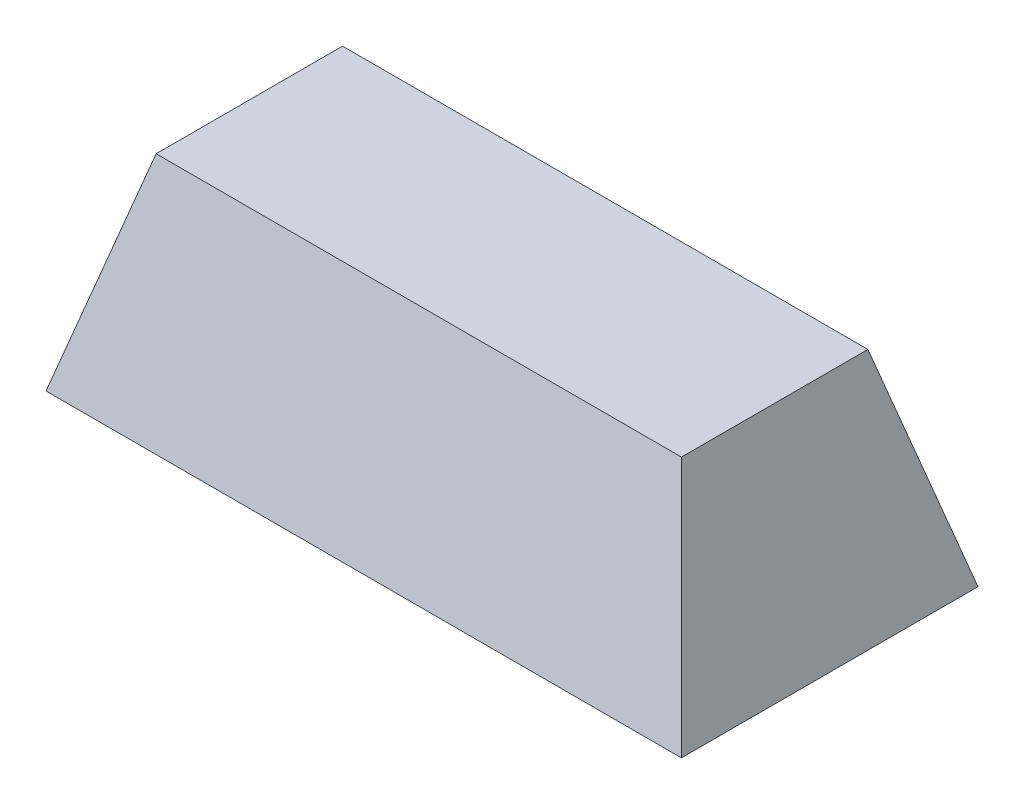
from build123d import *

# Parameters (mm, degrees)
ESQUISSE2_W      = 150
ESQUISSE2_H      = 70
EXTRUSION1_DEPTH = 48.5
EXTRUSION2_REACH = 174.488
CHANFREIN1_SIZE2 = 48.5
CHANFREIN1_SIZE  = 12.995535833
CHANFREIN2_SIZE2 = 48.5
CHANFREIN2_SIZE  = 12.995535833


with BuildPart() as part:
    # Esquisse2 → Extrusion1 (new body)
    with BuildSketch(Plane(origin=(0, 0, 0), x_dir=(1, 0, 0), z_dir=(0, 1, 0))):
        with Locations((75, 35)):
            Rectangle(ESQUISSE2_W, ESQUISSE2_H)
    extrude(amount=EXTRUSION1_DEPTH)

    # Esquisse3 → Extrusion2 (cut, up to next)
    with BuildSketch(Plane.XY, mode=Mode.PRIVATE) as extrusion2_sk1:
        Polygon((0, 0), (0, 48.5), (12.995535833, 48.5), align=None)
    extrusion2_tool1 = extrude(extrusion2_sk1.sketch, amount=-EXTRUSION2_REACH, mode=Mode.PRIVATE) & part.part
    # Esquisse3 → Extrusion2 (cut, up to next)
    with BuildSketch(Plane.XY, mode=Mode.PRIVATE) as extrusion2_sk2:
        Polygon((137.004464167, 48.5), (150, 0), (150, 48.5), align=None)
    extrusion2_tool2 = extrude(extrusion2_sk2.sketch, amount=-EXTRUSION2_REACH, mode=Mode.PRIVATE) & part.part
    add(extrusion2_tool1.solids().sort_by_distance((4.331845, 32.333333, 0))[0], mode=Mode.SUBTRACT)
    add(extrusion2_tool2.solids().sort_by_distance((145.668155, 32.333333, 0))[0], mode=Mode.SUBTRACT)

    # Chanfrein1
    chanfrein1_edges = [part.edges().sort_by_distance(p)[0] for p in [
        (75, 48.5, -70),
    ]]
    chanfrein1_side = [part.faces().sort_by_distance(p)[0] for p in [
        (75, 48.5, -69.740089283),
    ]]
    chamfer(chanfrein1_edges, length=CHANFREIN1_SIZE - 0.0001, length2=CHANFREIN1_SIZE2 - 0.0001, reference=chanfrein1_side[0])  # a hair under: the kernel refuses the full size

    # Chanfrein2
    chanfrein2_edges = [part.edges().sort_by_distance(p)[0] for p in [
        (75, 48.5, 0),
    ]]
    chanfrein2_side = [part.faces().sort_by_distance(p)[0] for p in [
        (75, 48.5, -0.259910717),
    ]]
    chamfer(chanfrein2_edges, length=CHANFREIN2_SIZE - 0.0001, length2=CHANFREIN2_SIZE2 - 0.0001, reference=chanfrein2_side[0])  # a hair under: the kernel refuses the full size


solid = part.part
